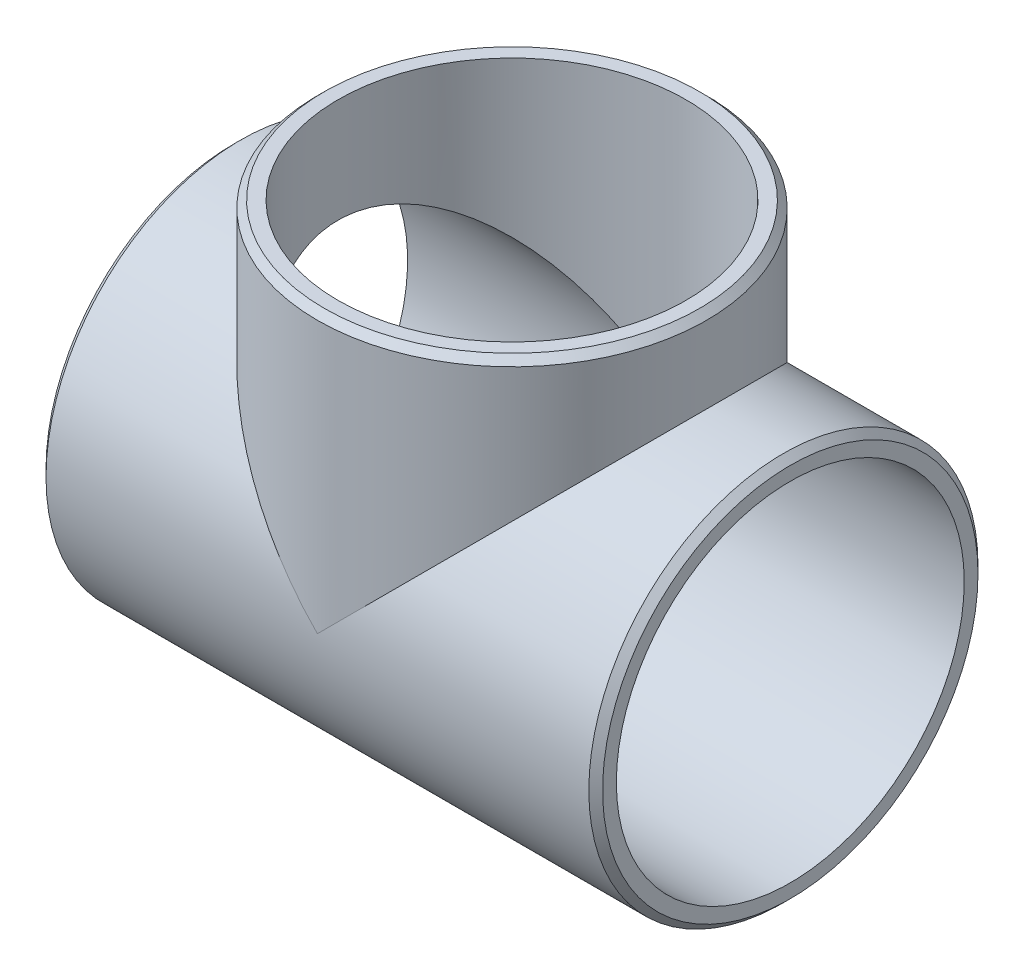
from build123d import *

# Parameters (mm, degrees)
RUNROUTE_R           = 17.9
RUNEXTRUDE_DEPTH     = 25.6
OUTLETROUTE_R        = 17.9
OUTLETEXTRUDE_DEPTH  = 25.6
TEESHELL_START       = -25.6
TEESHELL_OUTLINE_R   = 16
TEESHELL_DEPTH       = 51.2
TEESHELL_START_2     = -1e-07
TEESHELL_2_OUTLINE_R = 16
TEESHELL_2_DEPTH     = 25.6000001
TEECHAMFER_SIZE      = 0.633333333


with BuildPart() as part:
    # RunRoute → RunExtrude (new body)
    with BuildSketch(Plane(origin=(0, 0, 0), x_dir=(0, 0, -1), z_dir=(1, 0, 0))):
        Circle(RUNROUTE_R)
    runextrude = extrude(amount=RUNEXTRUDE_DEPTH)

    # RunExtrudeMirror: RunExtrude across plane
    add(runextrude.mirror(Plane(origin=(0, 0, 0), x_dir=(0, 0, 1), z_dir=(1, 0, 0))))

    # OutletRoute → OutletExtrude (add)
    with BuildSketch(Plane(origin=(0, 0, 0), x_dir=(1, 0, 0), z_dir=(0, 1, 0))):
        with Locations(Location((0, 0, 0), (0, 0, 270))):
            Circle(OUTLETROUTE_R)
    extrude(amount=OUTLETEXTRUDE_DEPTH)

    # TeeShell: read off the stored shape, not the designer's step
    # TeeShell outline → TeeShell (cut)
    with BuildSketch(Plane.YZ.offset(TEESHELL_START)):
        Circle(TEESHELL_OUTLINE_R)
    extrude(amount=TEESHELL_DEPTH, mode=Mode.SUBTRACT)

    # TeeShell 2 outline → TeeShell 2 (cut)
    with BuildSketch(Plane(origin=(0, 0, 0), x_dir=(1, 0, 0), z_dir=(0, 1, 0)).offset(TEESHELL_START_2)):
        Circle(TEESHELL_2_OUTLINE_R)
    extrude(amount=TEESHELL_2_DEPTH, mode=Mode.SUBTRACT)

    # TeeChamfer
    # the kernel refuses this chamfer: 0.633333333 mm, written as the material it takes off along each edge
    with BuildSketch(Plane(origin=(25.6, 0, 0), x_dir=(0, 0, -1), z_dir=(0, -1, 0))) as teechamfer_piece_1:
        Polygon((17.9, -TEECHAMFER_SIZE), (17.9 - TEECHAMFER_SIZE, 0), (17.9, 0), align=None)
    revolve(axis=Axis((25.6, 0, 0), (1, 0, 0)), mode=Mode.SUBTRACT)
    with BuildSketch(Plane(origin=(-25.6, 0, 0), x_dir=(0, 0, -1), z_dir=(0, -1, 0))) as teechamfer_piece_2:
        Polygon((17.9, TEECHAMFER_SIZE), (17.9 - TEECHAMFER_SIZE, 0), (17.9, 0), align=None)
    revolve(axis=Axis((-25.6, 0, 0), (1, 0, 0)), mode=Mode.SUBTRACT)
    with BuildSketch(Plane(origin=(0, 25.6, 0), x_dir=(0, 0, 1), z_dir=(-1, 0, 0))) as teechamfer_piece_3:
        Polygon((17.9, -TEECHAMFER_SIZE), (17.9 - TEECHAMFER_SIZE, 0), (17.9, 0), align=None)
    revolve(axis=Axis((0, 25.6, 0), (0, 1, 0)), mode=Mode.SUBTRACT)


solid = part.part
